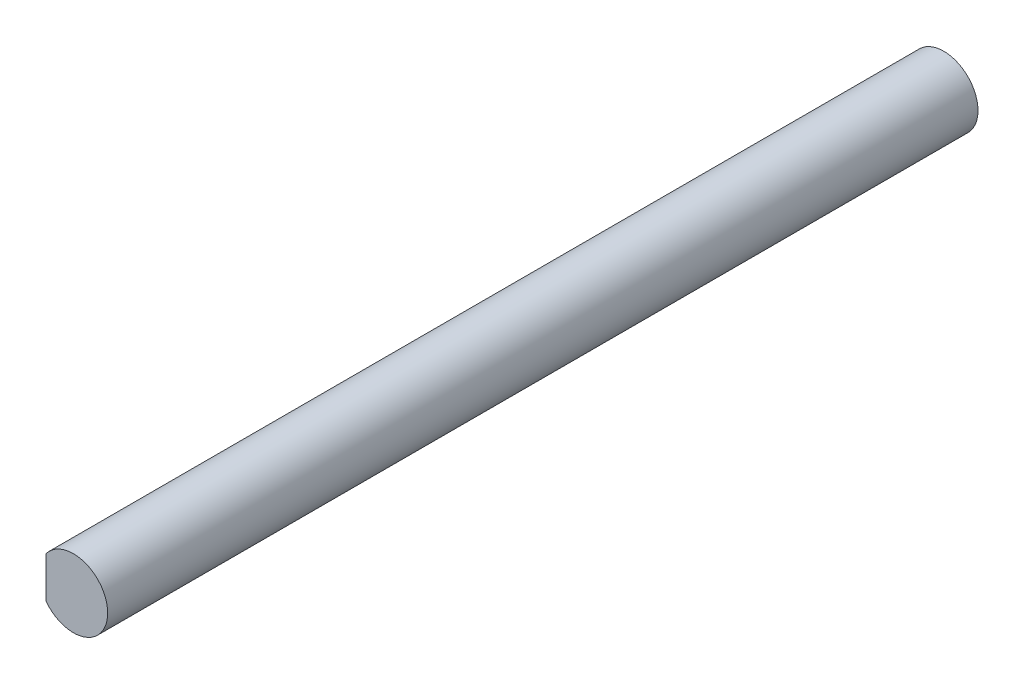
from build123d import *

# Parameters (mm, degrees)
BOSS_EXTRUDE1_DEPTH = 76.2


with BuildPart() as part:
    # Sketch1 → Boss-Extrude1 (new body)
    with BuildSketch(Plane.XY):
        with BuildLine():
            Line((-2.4, 0), (-2.4, 1.8))
            ThreePointArc((-2.4, 1.8), (3, 0), (-2.4, -1.8))
            Line((-2.4, -1.8), (-2.4, 0))
        make_face()
    extrude(amount=BOSS_EXTRUDE1_DEPTH)


solid = part.part
